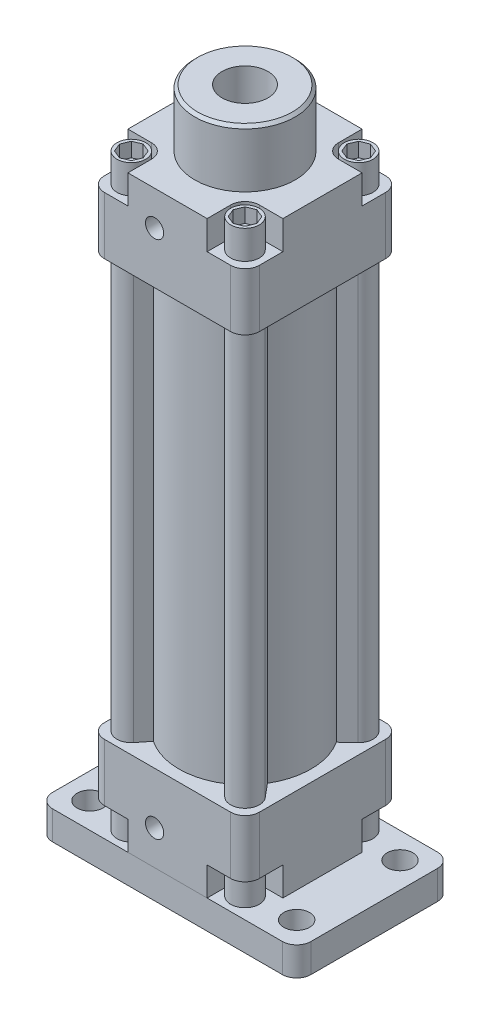
from build123d import *

# Parameters (mm, degrees)
SKETCH1_W                    = 54
SKETCH1_H                    = 54
BOSS_EXTRUDE1_DEPTH          = 20
SKETCH2_R                    = 5
BOSS_EXTRUDE2_DEPTH          = 10
FILLET1_R                    = 5
FILLET3_R                    = 5
CUT_EXTRUDE1_DEPTH           = 5
SKETCH4_R                    = 17.5
BOSS_EXTRUDE3_DEPTH          = 5.5
CHAMFER1_SIZE                = 1
BOSS_EXTRUDE4_START          = 145
SKETCH5_R                    = 20
SKETCH5_R_2                  = 2.5
BOSS_EXTRUDE4_DEPTH          = 145
CUT_EXTRUDE3_DEPTH           = 168
CUT_EXTRUDE3_DEPTH_BACK      = 22
SKETCH20_R                   = 20
BOSS_EXTRUDE5_START          = 20
BOSS_EXTRUDE5_DEPTH          = 20
F_5_0_5_DIAMETER_HOLE2_D     = 5
F_5_0_5_DIAMETER_HOLE2_DEPTH = 13
F_5_0_5_DIAMETER_HOLE2_TIP   = 1.502151548
BOSS_EXTRUDE6_START          = 10
SKETCH15_R                   = 5
BOSS_EXTRUDE6_DEPTH          = 10
CUT_EXTRUDE2_DEPTH           = 5
F_5_0_5_DIAMETER_HOLE3_D     = 5
F_5_0_5_DIAMETER_HOLE3_DEPTH = 13
F_5_0_5_DIAMETER_HOLE3_TIP   = 1.502151548
CUT_EXTRUDE4_START           = -24
SKETCH21_R                   = 20
CUT_EXTRUDE4_DEPTH           = 24
SKETCH22_R                   = 3.175
CUT_EXTRUDE5_DEPTH           = 24
BOSS_EXTRUDE7_START          = 20
SKETCH23_R                   = 17.5
BOSS_EXTRUDE7_DEPTH          = 20
CHAMFER2_SIZE                = 1
SKETCH26_R                   = 8
CUT_EXTRUDE6_DEPTH           = 169
SKETCH27_W                   = 90
SKETCH27_H                   = 54
SKETCH27_R                   = 17.5
SKETCH27_R_2                 = 5
SKETCH27_R_3                 = 4.5
BOSS_EXTRUDE9_DEPTH          = 10
FILLET4_R                    = 5


with BuildPart() as part:
    # Sketch1 → Boss-Extrude1 (new body)
    with BuildSketch(Plane(origin=(0, 0, 0), x_dir=(1, 0, 0), z_dir=(0, 1, 0))):
        Rectangle(SKETCH1_W, SKETCH1_H)
    extrude(amount=BOSS_EXTRUDE1_DEPTH)

    # Sketch2 → Boss-Extrude2 (add)
    with BuildSketch(Plane.XZ):
        with Locations((19.798989873, 19.798989873)):
            Circle(SKETCH2_R)
        with Locations((19.798989873, -19.798989873)):
            Circle(SKETCH2_R)
        with Locations((-19.798989873, -19.798989873)):
            Circle(SKETCH2_R)
        with Locations((-19.798989873, 19.798989873)):
            Circle(SKETCH2_R)
        Polygon((-13.798989873, 23.798989873), (-13.798989873, 27), (13.798989873, 27), (13.798989873, 23.798989873), (13.798989873, 13.798989873), (23.798989873, 13.798989873), (27, 13.798989873), (27, -13.798989873), (23.798989873, -13.798989873), (13.798989873, -13.798989873), (13.798989873, -23.798989873), (13.798989873, -27), (-13.798989873, -27), (-13.798989873, -23.798989873), (-13.798989873, -13.798989873), (-23.798989873, -13.798989873), (-27, -13.798989873), (-27, 13.798989873), (-23.798989873, 13.798989873), (-13.798989873, 13.798989873), align=None)
    extrude(amount=BOSS_EXTRUDE2_DEPTH)

    # Fillet1
    fillet1_edges = [part.edges().sort_by_distance(p)[0] for p in [
        (13.798989873, -5, 13.798989873),
        (13.798989873, -5, -13.798989873),
        (-13.798989873, -5, -13.798989873),
        (-13.798989873, -5, 13.798989873),
    ]]
    fillet(fillet1_edges, radius=FILLET1_R)

    # Fillet3
    fillet3_edges = [part.edges().sort_by_distance(p)[0] for p in [
        (-27, 10, -27),
        (27, 10, -27),
        (27, 10, 27),
        (-27, 10, 27),
    ]]
    fillet(fillet3_edges, radius=FILLET3_R)

    # Sketch3 → Cut-Extrude1 (cut)
    with BuildSketch(Plane.XZ.offset(10)):
        Polygon((15.649579155, 19.798989873), (16.864913416, 16.864913416), (19.798989873, 15.649579155), (22.73306633, 16.864913416), (23.948400592, 19.798989873), (22.73306633, 22.73306633), (19.798989873, 23.948400592), (16.864913416, 22.73306633), align=None)
        Polygon((-16.864913416, 16.864913416), (-19.798989873, 15.649579155), (-22.73306633, 16.864913416), (-23.948400592, 19.798989873), (-22.73306633, 22.73306633), (-19.798989873, 23.948400592), (-16.864913416, 22.73306633), (-15.649579155, 19.798989873), align=None)
        Polygon((-15.649579155, -19.798989873), (-16.864913416, -16.864913416), (-19.798989873, -15.649579155), (-22.73306633, -16.864913416), (-23.948400592, -19.798989873), (-22.73306633, -22.73306633), (-19.798989873, -23.948400592), (-16.864913416, -22.73306633), align=None)
        Polygon((16.864913416, -16.864913416), (19.798989873, -15.649579155), (22.73306633, -16.864913416), (23.948400592, -19.798989873), (22.73306633, -22.73306633), (19.798989873, -23.948400592), (16.864913416, -22.73306633), (15.649579155, -19.798989873), align=None)
    extrude(amount=-CUT_EXTRUDE1_DEPTH, mode=Mode.SUBTRACT)

    # Sketch4 → Boss-Extrude3 (add)
    with BuildSketch(Plane.XZ.offset(10)):
        Circle(SKETCH4_R)
    extrude(amount=BOSS_EXTRUDE3_DEPTH)

    # Chamfer1
    chamfer1_edges = [part.edges().sort_by_distance(p)[0] for p in [
        (-17.5, -15.5, 0),
    ]]
    chamfer(chamfer1_edges, length=CHAMFER1_SIZE)

    # Sketch5 → Boss-Extrude4 (add)
    with BuildSketch(Plane(origin=(0, 20, 0), x_dir=(1, 0, 0), z_dir=(0, 1, 0)).offset(BOSS_EXTRUDE4_START)):
        with BuildLine():
            Line((-15.7482792, 22.730157395), (-13.020058079, 18.959907374))
            ThreePointArc((-13.020058079, 18.959907374), (-0.181199077, 22.999286226), (12.719710463, 19.162697246))
            Line((12.719710463, 19.162697246), (15.97772799, 23.023576299))
            ThreePointArc((15.97772799, 23.023576299), (23.254015958, 23.413238724), (23.192353216, 16.126785464))
            Line((23.192353216, 16.126785464), (19.292053341, 12.522646601))
            ThreePointArc((19.292053341, 12.522646601), (22.996847004, 0.380825262), (19.696108925, -11.877006914))
            Line((19.696108925, -11.877006914), (23.636186164, -16.593381565))
            ThreePointArc((23.636186164, -16.593381565), (23.004598182, -23.636186164), (15.961793583, -23.004598182))
            Line((15.961793583, -23.004598182), (12.740637036, -19.148790247))
            ThreePointArc((12.740637036, -19.148790247), (-0.062784285, -22.999914307), (-12.844989651, -19.078947583))
            Line((-12.844989651, -19.078947583), (-15.882145464, -22.906775238))
            ThreePointArc((-15.882145464, -22.906775238), (-23.126116585, -23.531311917), (-23.334523779, -16.263455967))
            Line((-23.334523779, -16.263455967), (-19.410041772, -12.33897396))
            ThreePointArc((-19.410041772, -12.33897396), (-22.997803072, -0.31788971), (-19.743674583, 11.797767329))
            Line((-19.743674583, 11.797767329), (-23.680862449, 16.647630594))
            ThreePointArc((-23.680862449, 16.647630594), (-22.841424695, 23.766809218), (-15.7482792, 22.730157395))
        make_face()
        Circle(SKETCH5_R, mode=Mode.SUBTRACT)
        with Locations((-19.798989873, 19.798989873)):
            Circle(SKETCH5_R_2, mode=Mode.SUBTRACT)
        with Locations((19.798989873, 19.798989873)):
            Circle(SKETCH5_R_2, mode=Mode.SUBTRACT)
        with Locations((19.798989873, -19.798989873)):
            Circle(SKETCH5_R_2, mode=Mode.SUBTRACT)
        with Locations((-19.798989873, -19.798989873)):
            Circle(SKETCH5_R_2, mode=Mode.SUBTRACT)
    extrude(amount=-BOSS_EXTRUDE4_DEPTH)

    # Sketch20 → Cut-Extrude3 (cut, two sides: drawn at the far end of the back side and taken through both)
    with BuildSketch(Plane(origin=(0, 20, 0), x_dir=(1, 0, 0), z_dir=(0, 1, 0)).offset(-CUT_EXTRUDE3_DEPTH_BACK)):
        Circle(SKETCH20_R)
    extrude(amount=CUT_EXTRUDE3_DEPTH + CUT_EXTRUDE3_DEPTH_BACK, mode=Mode.SUBTRACT)

    # Sketch9 → Boss-Extrude5 (add)
    with BuildSketch(Plane(origin=(0, 165, 0), x_dir=(1, 0, 0), z_dir=(0, 1, 0)).offset(BOSS_EXTRUDE5_START)):
        with BuildLine():
            Line((22, 27), (-22, 27))
            ThreePointArc((-22, 27), (-25.535533906, 25.535533906), (-27, 22))
            Line((-27, 22), (-27, -22))
            ThreePointArc((-27, -22), (-25.535533906, -25.535533906), (-22, -27))
            Line((-22, -27), (22, -27))
            ThreePointArc((22, -27), (25.535533906, -25.535533906), (27, -22))
            Line((27, -22), (27, 22))
            ThreePointArc((27, 22), (25.535533906, 25.535533906), (22, 27))
        make_face()
    extrude(amount=-BOSS_EXTRUDE5_DEPTH)

    # Ø5.0 (5) Diameter Hole2
    with Locations(Plane(origin=(0, -5, 0), x_dir=(-1, 0, 0), z_dir=(0, -1, 0))):
        with Locations((-19.798989873, 19.798989873), (-19.798989873, -19.798989873), (19.798989873, 19.798989873), (19.798989873, -19.798989873)):
            Hole(F_5_0_5_DIAMETER_HOLE2_D / 2, depth=F_5_0_5_DIAMETER_HOLE2_DEPTH)
            with Locations((0, 0, -(F_5_0_5_DIAMETER_HOLE2_DEPTH + F_5_0_5_DIAMETER_HOLE2_TIP / 2))):  # 118° drill point
                Cone(0, F_5_0_5_DIAMETER_HOLE2_D / 2, F_5_0_5_DIAMETER_HOLE2_TIP, mode=Mode.SUBTRACT)

    # Sketch15 → Boss-Extrude6 (add)
    with BuildSketch(Plane(origin=(0, 185, 0), x_dir=(1, 0, 0), z_dir=(0, 1, 0)).offset(BOSS_EXTRUDE6_START)):
        with Locations((-19.798989873, 19.798989873)):
            Circle(SKETCH15_R)
        with Locations((19.798989873, 19.798989873)):
            Circle(SKETCH15_R)
        with Locations((19.798989873, -19.798989873)):
            Circle(SKETCH15_R)
        with Locations((-19.798989873, -19.798989873)):
            Circle(SKETCH15_R)
        with BuildLine():
            Line((-13.798989873, -27), (13.798989873, -27))
            Line((13.798989873, -27), (13.798989873, -18.798989873))
            ThreePointArc((13.798989873, -18.798989873), (15.263455967, -15.263455967), (18.798989873, -13.798989873))
            Line((18.798989873, -13.798989873), (27, -13.798989873))
            Line((27, -13.798989873), (27, 13.798989873))
            Line((27, 13.798989873), (18.798989873, 13.798989873))
            ThreePointArc((18.798989873, 13.798989873), (15.263455967, 15.263455967), (13.798989873, 18.798989873))
            Line((13.798989873, 18.798989873), (13.798989873, 27))
            Line((13.798989873, 27), (-13.798989873, 27))
            Line((-13.798989873, 27), (-13.798989873, 18.798989873))
            ThreePointArc((-13.798989873, 18.798989873), (-15.263455967, 15.263455967), (-18.798989873, 13.798989873))
            Line((-18.798989873, 13.798989873), (-27, 13.798989873))
            Line((-27, 13.798989873), (-27, -13.798989873))
            Line((-27, -13.798989873), (-18.798989873, -13.798989873))
            ThreePointArc((-18.798989873, -13.798989873), (-15.263455967, -15.263455967), (-13.798989873, -18.798989873))
            Line((-13.798989873, -18.798989873), (-13.798989873, -27))
        make_face()
    extrude(amount=-BOSS_EXTRUDE6_DEPTH)

    # Sketch16 → Cut-Extrude2 (cut)
    with BuildSketch(Plane(origin=(0, 195, 0), x_dir=(1, 0, 0), z_dir=(0, 1, 0))):
        Polygon((16.864913416, 22.73306633), (19.798989873, 23.948400592), (22.73306633, 22.73306633), (23.948400592, 19.798989873), (22.73306633, 16.864913416), (19.798989873, 15.649579155), (16.864913416, 16.864913416), (15.649579155, 19.798989873), align=None)
        Polygon((-22.73306633, 16.864913416), (-19.798989873, 15.649579155), (-16.864913416, 16.864913416), (-15.649579155, 19.798989873), (-16.864913416, 22.73306633), (-19.798989873, 23.948400592), (-22.73306633, 22.73306633), (-23.948400592, 19.798989873), align=None)
        Polygon((-16.864913416, -22.73306633), (-19.798989873, -23.948400592), (-22.73306633, -22.73306633), (-23.948400592, -19.798989873), (-22.73306633, -16.864913416), (-19.798989873, -15.649579155), (-16.864913416, -16.864913416), (-15.649579155, -19.798989873), align=None)
        Polygon((22.73306633, -16.864913416), (19.798989873, -15.649579155), (16.864913416, -16.864913416), (15.649579155, -19.798989873), (16.864913416, -22.73306633), (19.798989873, -23.948400592), (22.73306633, -22.73306633), (23.948400592, -19.798989873), align=None)
    extrude(amount=-CUT_EXTRUDE2_DEPTH, mode=Mode.SUBTRACT)

    # Ø5.0 (5) Diameter Hole3
    with Locations(Plane(origin=(0, 190, 0), x_dir=(1, 0, 0), z_dir=(0, 1, 0))):
        with Locations((-19.972751985, 19.798989873), (-19.798989873, -19.798989873), (19.798989873, -19.798989873), (19.798989873, 19.798989873)):
            Hole(F_5_0_5_DIAMETER_HOLE3_D / 2, depth=F_5_0_5_DIAMETER_HOLE3_DEPTH)
            with Locations((0, 0, -(F_5_0_5_DIAMETER_HOLE3_DEPTH + F_5_0_5_DIAMETER_HOLE3_TIP / 2))):  # 118° drill point
                Cone(0, F_5_0_5_DIAMETER_HOLE3_D / 2, F_5_0_5_DIAMETER_HOLE3_TIP, mode=Mode.SUBTRACT)

    # Sketch21 → Cut-Extrude4 (cut)
    with BuildSketch(Plane.XZ.offset(-165).offset(CUT_EXTRUDE4_START)):
        Circle(SKETCH21_R)
    extrude(amount=CUT_EXTRUDE4_DEPTH, mode=Mode.SUBTRACT)

    # Sketch22 → Cut-Extrude5 (cut)
    with BuildSketch(Plane.XY.offset(27)):
        with Locations((-4.5, 183)):
            Circle(SKETCH22_R)
        with Locations((-4.5, 2)):
            Circle(SKETCH22_R)
    extrude(amount=-CUT_EXTRUDE5_DEPTH, mode=Mode.SUBTRACT)

    # Sketch23 → Boss-Extrude7 (add)
    with BuildSketch(Plane(origin=(0, 195, 0), x_dir=(1, 0, 0), z_dir=(0, 1, 0)).offset(BOSS_EXTRUDE7_START)):
        Circle(SKETCH23_R)
    extrude(amount=-BOSS_EXTRUDE7_DEPTH)

    # Chamfer2
    chamfer2_edges = [part.edges().sort_by_distance(p)[0] for p in [
        (-17.5, 215, 0),
    ]]
    chamfer(chamfer2_edges, length=CHAMFER2_SIZE)

    # Sketch26 → Cut-Extrude6 (cut)
    with BuildSketch(Plane(origin=(0, 215, 0), x_dir=(1, 0, 0), z_dir=(0, 1, 0))):
        Circle(SKETCH26_R)
    extrude(amount=-CUT_EXTRUDE6_DEPTH, mode=Mode.SUBTRACT)


with BuildPart() as body_2:
    # Sketch27 → Boss-Extrude9 (new body)
    with BuildSketch(Plane.XZ.offset(10)):
        Rectangle(SKETCH27_W, SKETCH27_H)
        Circle(SKETCH27_R, mode=Mode.SUBTRACT)
        with Locations((-19.798989873, 19.798989873)):
            Circle(SKETCH27_R_2, mode=Mode.SUBTRACT)
        with Locations((19.798989873, 19.798989873)):
            Circle(SKETCH27_R_2, mode=Mode.SUBTRACT)
        with Locations((19.798989873, -19.798989873)):
            Circle(SKETCH27_R_2, mode=Mode.SUBTRACT)
        with Locations((-19.798989873, -19.798989873)):
            Circle(SKETCH27_R_2, mode=Mode.SUBTRACT)
        with Locations((36, 18)):
            Circle(SKETCH27_R_3, mode=Mode.SUBTRACT)
        with Locations((36, -18)):
            Circle(SKETCH27_R_3, mode=Mode.SUBTRACT)
        with Locations((-36, -18)):
            Circle(SKETCH27_R_3, mode=Mode.SUBTRACT)
        with Locations((-36, 18)):
            Circle(SKETCH27_R_3, mode=Mode.SUBTRACT)
    extrude(amount=BOSS_EXTRUDE9_DEPTH)

    # Fillet4
    fillet4_edges = [body_2.edges().sort_by_distance(p)[0] for p in [
        (-45, -15, 27),
        (45, -15, 27),
        (45, -15, -27),
        (-45, -15, -27),
    ]]
    fillet(fillet4_edges, radius=FILLET4_R)


solid = Compound([part.part, body_2.part])
